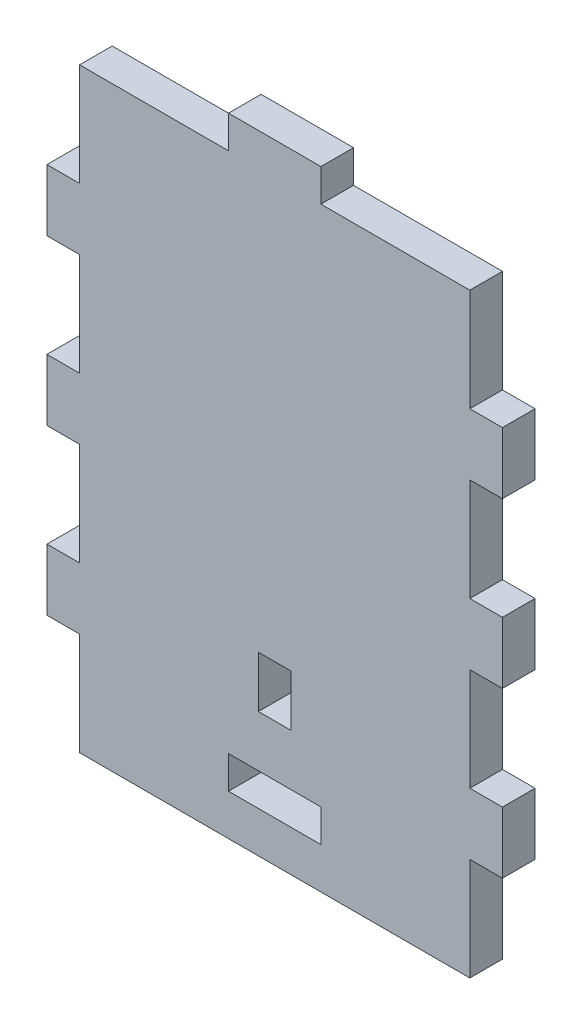
from build123d import *

# Parameters (mm, degrees)
BOSS_EXTRUDE2_DEPTH = 1.5875


with BuildPart() as part:
    # Sketch1 → Boss-Extrude2 (new, symmetric)
    with BuildSketch(Plane.XY):
        Polygon((-19, 0), (0, 0), (0, 10), (3.175, 10), (3.175, 16), (0, 16), (0, 26), (3.175, 26), (3.175, 32), (0, 32), (0, 42), (3.175, 42), (3.175, 48), (0, 48), (0, 58), (-14.5, 58), (-14.5, 61.175), (-23.5, 61.175), (-23.5, 58), (-38, 58), (-38, 48), (-41.175, 48), (-41.175, 42), (-38, 42), (-38, 32), (-41.175, 32), (-41.175, 26), (-38, 26), (-38, 16), (-41.175, 16), (-41.175, 10), (-38, 10), (-38, 0), align=None)
        Polygon((-14.5, 4), (-19, 4), (-23.5, 4), (-23.5, 7.175), (-19, 7.175), (-14.5, 7.175), align=None, mode=Mode.SUBTRACT)
        Polygon((-17.4125, 12.175), (-19, 12.175), (-20.5875, 12.175), (-20.5875, 17.175), (-17.4125, 17.175), align=None, mode=Mode.SUBTRACT)
    extrude(amount=BOSS_EXTRUDE2_DEPTH, both=True)


solid = part.part
